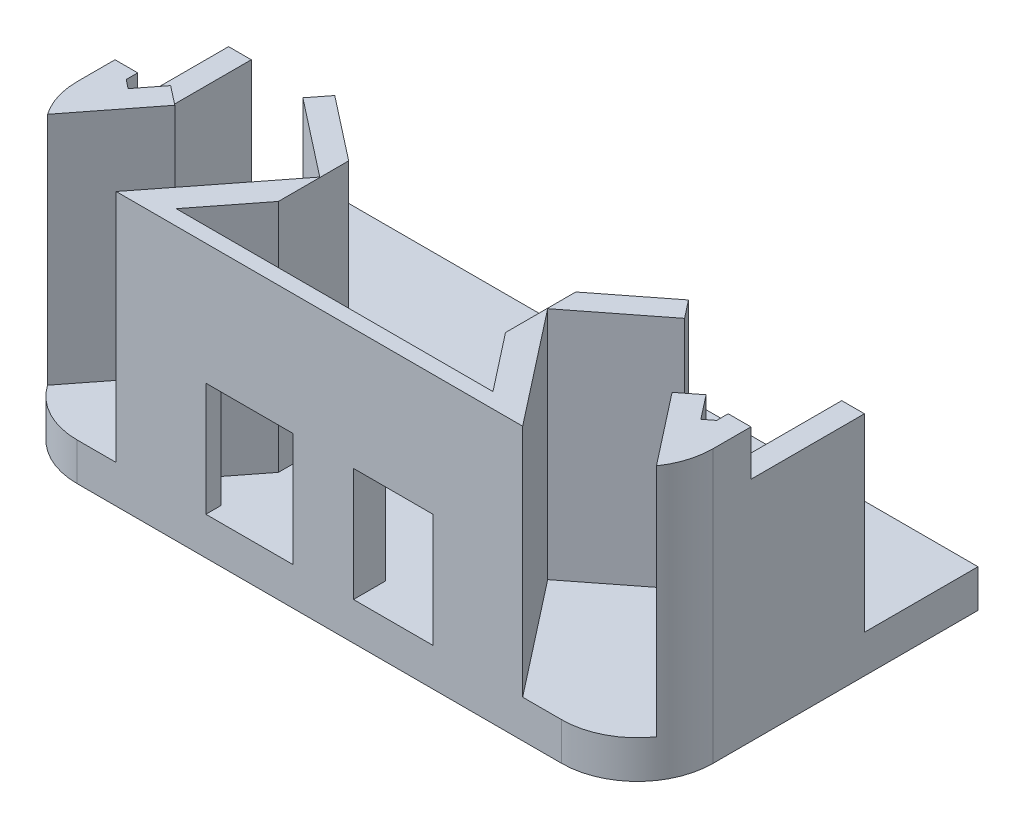
from build123d import *

# Parameters (mm, degrees)
SKETCH_1_W           = 84
SKETCH_1_H           = 30
EXTRUDE_1_DEPTH      = 34
CUT_EXTRUDE_1_DEPTH  = 30
SKETCH_4_W           = 15
SKETCH_4_H           = 18
CUT_EXTRUDE_4_DEPTH  = 30
CUT_EXTRUDE_6_DEPTH  = 30
SKETCH_8_W           = 78
SKETCH_8_H           = 28
CUT_EXTRUDE_7_DEPTH  = 30
EXTRUDE_4_DEPTH      = 30
EXTRUDE_5_DEPTH      = 30
SKETCH_11_W          = 30
SKETCH_11_H          = 18
CUT_EXTRUDE_9_DEPTH  = 61.860496219
CUT_EXTRUDE_12_DEPTH = 30
EXTRUDE_6_DEPTH      = 30
EXTRUDE_9_DEPTH      = 8
CUT_EXTRUDE_16_DEPTH = 30
EXTRUDE_10_DEPTH     = 30
SKETCH_27_W          = 84
SKETCH_27_H          = 1
CUT_EXTRUDE_17_DEPTH = 62.806148561
SKETCH_28_W          = 26.41372768
SKETCH_28_H          = 2
CUT_EXTRUDE_18_DEPTH = 12
SKETCH_29_W          = 2
SKETCH_29_H          = 18
EXTRUDE_11_DEPTH     = 30
SKETCH_30_W          = 30
SKETCH_30_H          = 18.863254254
CUT_EXTRUDE_19_DEPTH = 12
SKETCH_31_W          = 30
SKETCH_31_H          = 3
CUT_EXTRUDE_20_DEPTH = 12
SKETCH_32_W          = 15
SKETCH_32_H          = 5
CUT_EXTRUDE_21_DEPTH = 10
SKETCH_33_W          = 15
SKETCH_33_H          = 5
CUT_EXTRUDE_22_DEPTH = 10
SKETCH_39_W          = 30
SKETCH_39_H          = 3
EXTRUDE_12_DEPTH     = 1
CHAMFER_1_SIZE       = 10
CHAMFER_1_SIZE_2     = 5.773502692
EXTRUDE_13_DEPTH     = 8
EXTRUDE_14_DEPTH     = 22
FILLET_1_R           = 10
SKETCH_44_W          = 3.5
SKETCH_44_H          = 4.2
SKETCH_44_W_2        = 4.5
EXTRUDE_16_DEPTH     = 15
EXTRUDE_START        = 1
EXTRUDE_17_DEPTH     = 1
EXTRUDE_20_DEPTH     = 2
EXTRUDE_21_DEPTH     = 5
SKETCH_52_R          = 1.75
CUT_EXTRUDE_23_DEPTH = 10


with BuildPart() as part:
    # 草图1 → 凸台-拉伸1 (new body)
    with BuildSketch(Plane(origin=(0, 0, 0), x_dir=(1, 0, 0), z_dir=(0, 1, 0))):
        Rectangle(SKETCH_1_W, SKETCH_1_H)
    extrude(amount=EXTRUDE_1_DEPTH)

    # 草图2 → 切除-拉伸1 (cut)
    with BuildSketch(Plane(origin=(0, 34, 0), x_dir=(1, 0, 0), z_dir=(0, 1, 0))):
        Polygon((-39, 15), (-3.161634299, -13), (3.161634299, -13), (39, 15), align=None)
    extrude(amount=-CUT_EXTRUDE_1_DEPTH, mode=Mode.SUBTRACT)

    # 草图4 → 切除-拉伸4 (cut)
    with BuildSketch(Plane.XY.offset(15)):
        with Locations((-7.5, 25)):
            Rectangle(SKETCH_4_W, SKETCH_4_H)
        with Locations((7.5, 25)):
            Rectangle(SKETCH_4_W, SKETCH_4_H)
    extrude(amount=-CUT_EXTRUDE_4_DEPTH, mode=Mode.SUBTRACT)

    # 草图3 → 切除-拉伸6 (cut)
    with BuildSketch(Plane(origin=(0, 34, 0), x_dir=(1, 0, 0), z_dir=(0, 1, 0))):
        Polygon((-26.356961736, 5.122175929), (-42, -14.9), (-42, -15), (-26.849909982, -15), (-16.900832692, -2.265761775), align=None)
        Polygon((42, -14.9), (26.356961736, 5.122175929), (16.900832692, -2.265761775), (26.849909982, -15), (42, -15), align=None)
    extrude(amount=-CUT_EXTRUDE_6_DEPTH, mode=Mode.SUBTRACT)

    # 草图8 → 切除-拉伸7 (cut)
    with BuildSketch(Plane(origin=(0, 34, 0), x_dir=(1, 0, 0), z_dir=(0, 1, 0))):
        with Locations((0, 1)):
            Rectangle(SKETCH_8_W, SKETCH_8_H)
    extrude(amount=-CUT_EXTRUDE_7_DEPTH, mode=Mode.SUBTRACT)

    # 草图6 → 凸台-拉伸4 (add)
    with BuildSketch(Plane(origin=(0, 4, 0), x_dir=(1, 0, 0), z_dir=(0, 1, 0))):
        Polygon((-24.50997731, 7.486208189), (-15.053848266, 0.098270486), (-13.20686384, 2.462302746), (-22.662992884, 9.85024045), align=None)
        Polygon((13.20686384, 2.462302746), (22.662992884, 9.85024045), (24.50997731, 7.486208189), (15.053848266, 0.098270486), align=None)
    extrude(amount=EXTRUDE_4_DEPTH)

    # 草图9 → 凸台-拉伸5 (add)
    with BuildSketch(Plane(origin=(0, 4, 0), x_dir=(1, 0, 0), z_dir=(0, 1, 0))):
        Polygon((13.20686384, 2.462302746), (13.20686384, -13), (24.529623979, -13), (25.287338729, -13), (15.053848266, 0.098270486), align=None)
        Polygon((-15.053848266, 0.098270486), (-25.287338729, -13), (-24.529623979, -13), (-13.20686384, -13), (-13.20686384, 2.462302746), align=None)
    extrude(amount=EXTRUDE_5_DEPTH)

    # 草图11 → 切除-拉伸9 (cut, through all)
    with BuildSketch(Plane.XY.offset(13)):
        with Locations((0, 25)):
            Rectangle(SKETCH_11_W, SKETCH_11_H)
    extrude(amount=-CUT_EXTRUDE_9_DEPTH, mode=Mode.SUBTRACT)

    # 草图14 → 切除-拉伸12 (cut)
    with BuildSketch(Plane(origin=(0, 34, 0), x_dir=(1, 0, 0), z_dir=(0, 1, 0))):
        Polygon((-15, -5.416722485), (-20.924705724, -13), (-15, -13), align=None)
        Polygon((15, -13), (20.924705724, -13), (15, -5.416722485), align=None)
    extrude(amount=-CUT_EXTRUDE_12_DEPTH, mode=Mode.SUBTRACT)

    # 草图17 → 凸台-拉伸6 (add)
    with BuildSketch(Plane(origin=(0, 4, 0), x_dir=(1, 0, 0), z_dir=(0, 1, 0))):
        Polygon((-22.662992884, 9.85024045), (-23.392760551, 10.420397439), (-25.239744977, 8.056365178), (-24.50997731, 7.486208189), align=None)
        Polygon((22.662992884, 9.85024045), (23.359699806, 10.394567554), (25.206684232, 8.030535294), (24.50997731, 7.486208189), align=None)
    extrude(amount=EXTRUDE_6_DEPTH)

    # 草图23 → 凸台-拉伸9 (add)
    with BuildSketch(Plane(origin=(0, 4, 0), x_dir=(1, 0, 0), z_dir=(0, 1, 0))):
        Polygon((23.359699806, 10.394567554), (26.117737443, 12.549382718), (32.274352197, 4.669275182), (29.752717785, 2.699158461), (25.443087458, 8.215233736), (25.206684232, 8.030535294), align=None)
        Polygon((-25.206684232, 8.030535294), (-23.359699806, 10.394567554), (-26.117737443, 12.549382718), (-32.274352197, 4.669275182), (-29.752717785, 2.699158461), (-25.443087458, 8.215233736), align=None)
    extrude(amount=EXTRUDE_9_DEPTH)

    # 草图25 → 切除-拉伸16 (cut)
    with BuildSketch(Plane(origin=(0, 34, 0), x_dir=(1, 0, 0), z_dir=(0, 1, 0))):
        Polygon((-39, -11.060175103), (-39, -9.136823031), (-42, -12.976647927), (-42, -14.9), align=None)
        Polygon((42, -12.976647927), (42, -14.9), (39, -11.060175103), (39, -9.136823031), align=None)
    extrude(amount=-CUT_EXTRUDE_16_DEPTH, mode=Mode.SUBTRACT)

    # 草图26 → 凸台-拉伸10 (add)
    with BuildSketch(Plane(origin=(0, 4, 0), x_dir=(1, 0, 0), z_dir=(0, 1, 0))):
        Polygon((-39, -9.136823031), (-35.306031148, -4.408758509), (-39, -1.52271374), align=None)
        Polygon((39, -1.52271374), (39, -9.136823031), (35.306031148, -4.408758509), align=None)
    extrude(amount=EXTRUDE_10_DEPTH)

    # 草图27 → 切除-拉伸17 (cut, through all)
    with BuildSketch(Plane(origin=(0, 0, -15), x_dir=(-1, 0, 0), z_dir=(0, 0, -1))):
        with Locations((0, 0.5)):
            Rectangle(SKETCH_27_W, SKETCH_27_H)
    extrude(amount=-CUT_EXTRUDE_17_DEPTH, mode=Mode.SUBTRACT)

    # 草图28 → 切除-拉伸18 (cut)
    with BuildSketch(Plane(origin=(0, 16, 0), x_dir=(1, 0, 0), z_dir=(0, 1, 0))):
        with Locations((0, -14)):
            Rectangle(SKETCH_28_W, SKETCH_28_H)
    extrude(amount=-CUT_EXTRUDE_18_DEPTH, mode=Mode.SUBTRACT)

    # 草图29 → 凸台-拉伸11 (add)
    with BuildSketch(Plane(origin=(-15, 0, 0), x_dir=(0, 0, -1), z_dir=(1, 0, 0))):
        with Locations((-14, 25)):
            Rectangle(SKETCH_29_W, SKETCH_29_H)
    extrude(amount=EXTRUDE_11_DEPTH)

    # 草图30 → 切除-拉伸19 (cut)
    with BuildSketch(Plane(origin=(0, 16, 0), x_dir=(1, 0, 0), z_dir=(0, 1, 0))):
        with Locations((0, -5.568372873)):
            Rectangle(SKETCH_30_W, SKETCH_30_H)
    extrude(amount=-CUT_EXTRUDE_19_DEPTH, mode=Mode.SUBTRACT)

    # 草图31 → 切除-拉伸20 (cut)
    with BuildSketch(Plane.XY.offset(15)):
        with Locations((0, 17.5)):
            Rectangle(SKETCH_31_W, SKETCH_31_H)
    extrude(amount=-CUT_EXTRUDE_20_DEPTH, mode=Mode.SUBTRACT)

    # 草图32 → 切除-拉伸21 (cut)
    with BuildSketch(Plane.ZY.offset(42)):
        with Locations((-7.5, 31.5)):
            Rectangle(SKETCH_32_W, SKETCH_32_H)
    extrude(amount=-CUT_EXTRUDE_21_DEPTH, mode=Mode.SUBTRACT)

    # 草图33 → 切除-拉伸22 (cut)
    with BuildSketch(Plane(origin=(42, 0, 0), x_dir=(0, 0, -1), z_dir=(1, 0, 0))):
        with Locations((7.5, 31.5)):
            Rectangle(SKETCH_33_W, SKETCH_33_H)
    extrude(amount=-CUT_EXTRUDE_22_DEPTH, mode=Mode.SUBTRACT)

    # 草图39 → 凸台-拉伸12 (add)
    with BuildSketch(Plane(origin=(0, 0, -15), x_dir=(-1, 0, 0), z_dir=(0, 0, -1))):
        with Locations((0, 2.5)):
            Rectangle(SKETCH_39_W, SKETCH_39_H)
    extrude(amount=EXTRUDE_12_DEPTH)

    # 倒角1
    # the kernel refuses this chamfer: 10, 5.773502692 mm, written as the material it adds along each edge
    with BuildSketch(Plane(origin=(-15, 4, -15), x_dir=(-0.9998132206222079, 0, 0.01932676561270081), z_dir=(0, -1, 0))) as chamfer_1_piece_1_section:
        Polygon((CHAMFER_1_SIZE * 0.999813220622, CHAMFER_1_SIZE * 0.0193267656127), (-CHAMFER_1_SIZE_2 * 0.0193267656124, CHAMFER_1_SIZE_2 * 0.999813220604), (0, 0), align=None)
    chamfer_1_piece_1 = extrude(amount=3, mode=Mode.PRIVATE)
    chamfer_1_piece_1 = split(chamfer_1_piece_1, bisect_by=Plane(origin=(-19.75963278, 2.5, -16), z_dir=(0, 0, 1)), keep=Keep.TOP, mode=Mode.PRIVATE)
    add(chamfer_1_piece_1)
    with BuildSketch(Plane(origin=(15, 1, -15), x_dir=(0.9998132206222079, 0, 0.01932676561270081), z_dir=(0, 1, 0))) as chamfer_1_piece_2_section:
        Polygon((CHAMFER_1_SIZE * 0.999813220622, CHAMFER_1_SIZE * 0.0193267656127), (-CHAMFER_1_SIZE_2 * 0.0193267656124, CHAMFER_1_SIZE_2 * 0.999813220604), (0, 0), align=None)
    chamfer_1_piece_2 = extrude(amount=3, mode=Mode.PRIVATE)
    chamfer_1_piece_2 = split(chamfer_1_piece_2, bisect_by=Plane(origin=(19.75963278, 2.5, -16), z_dir=(0, 0, 1)), keep=Keep.TOP, mode=Mode.PRIVATE)
    add(chamfer_1_piece_2)

    # 草图41 → 凸台-拉伸13 (add)
    with BuildSketch(Plane(origin=(0, 4, 0), x_dir=(1, 0, 0), z_dir=(0, 1, 0))):
        Polygon((-32.274352197, 4.669275182), (-37.82766556, -2.438641788), (-35.306031148, -4.408758509), (-29.752717785, 2.699158461), align=None)
        Polygon((29.752717785, 2.699158461), (35.306031148, -4.408758509), (37.82766556, -2.438641788), (32.274352197, 4.669275182), align=None)
    extrude(amount=EXTRUDE_13_DEPTH)

    # 草图42 → 凸台-拉伸14 (add)
    with BuildSketch(Plane(origin=(0, 12, 0), x_dir=(1, 0, 0), z_dir=(0, 1, 0))):
        Polygon((35.306031148, -4.408758509), (32.843385247, -1.256715495), (35.365019658, 0.713401226), (37.82766556, -2.438641788), align=None)
        Polygon((-37.82766556, -2.438641788), (-35.306031148, -4.408758509), (-32.843385247, -1.256715495), (-35.365019658, 0.713401226), align=None)
    extrude(amount=EXTRUDE_14_DEPTH)

    # 圆角1
    fillet_1_edges = [part.edges().sort_by_distance(p)[0] for p in [
        (42, 2.5, 15),
        (-42, 2.5, 15),
    ]]
    fillet(fillet_1_edges, radius=FILLET_1_R)

    # 草图44 → 凸台-拉伸16 (add)
    with BuildSketch(Plane(origin=(0, 4, 0), x_dir=(1, 0, 0), z_dir=(0, 1, 0))):
        with Locations((-1.75, -12.9)):
            Rectangle(SKETCH_44_W, SKETCH_44_H)
        with Locations((2.25, -12.9)):
            Rectangle(SKETCH_44_W_2, SKETCH_44_H)
    extrude(amount=EXTRUDE_16_DEPTH)

    # 草图47 → 凸台-拉伸17 (add)
    with BuildSketch(Plane(origin=(0, 34, 0), x_dir=(1, 0, 0), z_dir=(0, 1, 0)).offset(EXTRUDE_START)):
        with BuildLine():
            Line((32.843385247, -1.256715495), (40.218723124, -10.696717495))
            ThreePointArc((40.218723124, -10.696717495), (41.544297545, -7.984356611), (42, -5))
            Line((42, -5), (42, 0))
            Line((42, 0), (39, 0))
            Line((39, 0), (39, -1.52271374))
            Line((39, -1.52271374), (37.82766556, -2.438641788))
            Line((37.82766556, -2.438641788), (35.365019658, 0.713401226))
            Line((35.365019658, 0.713401226), (32.843385247, -1.256715495))
        make_face()
        with BuildLine():
            Line((-42, 0), (-42, -5))
            ThreePointArc((-42, -5), (-41.544297545, -7.984356611), (-40.218723124, -10.696717495))
            Line((-40.218723124, -10.696717495), (-32.843385247, -1.256715495))
            Line((-32.843385247, -1.256715495), (-35.365019658, 0.713401226))
            Line((-35.365019658, 0.713401226), (-37.82766556, -2.438641788))
            Line((-37.82766556, -2.438641788), (-39, -1.52271374))
            Line((-39, -1.52271374), (-39, 0))
            Line((-39, 0), (-42, 0))
        make_face()
        Polygon((15, -5.416722485), (20.924705724, -13), (-20.924705724, -13), (-15, -5.416722485), (-15, 3.863254254), (-23.392760551, 10.420397439), (-25.239744977, 8.056365178), (-15.053848266, 0.098270486), (-26.849909982, -15), (26.849909982, -15), (15.053848266, 0.098270486), (25.206684232, 8.030535294), (23.359699806, 10.394567554), (15, 3.863254254), align=None)
    extrude(amount=-EXTRUDE_17_DEPTH)

    # 草图50 → 凸台-拉伸20 (add)
    with BuildSketch(Plane.XZ.offset(-1)):
        with BuildLine():
            Line((-42, -15), (-25, -15))
            Line((-25, -15), (-23.267949192, -16))
            Line((-23.267949192, -16), (23.267949192, -16))
            Line((23.267949192, -16), (25, -15))
            Line((25, -15), (42, -15))
            Line((42, -15), (42, 5))
            ThreePointArc((42, 5), (39.071067812, 12.071067812), (32, 15))
            Line((32, 15), (-32, 15))
            ThreePointArc((-32, 15), (-39.071067812, 12.071067812), (-42, 5))
            Line((-42, 5), (-42, -15))
        make_face()
    extrude(amount=EXTRUDE_20_DEPTH)

    # 草图51 → 凸台-拉伸21 (add)
    with BuildSketch(Plane(origin=(0, 4, 0), x_dir=(1, 0, 0), z_dir=(0, 1, 0))):
        Polygon((-42, 15), (-25, 15), (-23.267949192, 16), (23.267949192, 16), (25, 15), (42, 15), (42, 30), (-42, 30), align=None)
    extrude(amount=-EXTRUDE_21_DEPTH)

    # 草图52 → 切除-拉伸23 (cut)
    with BuildSketch(Plane.XZ.offset(1)):
        with Locations(Location((35, -17, 0), (0, 0, 270))):
            Circle(SKETCH_52_R)
        with Locations(Location((9, -23, 0), (0, 0, 270))):
            Circle(SKETCH_52_R)
        with Locations(Location((-9, -23, 0), (0, 0, 270))):
            Circle(SKETCH_52_R)
        with Locations(Location((-35, -17, 0), (0, 0, 270))):
            Circle(SKETCH_52_R)
    extrude(amount=-CUT_EXTRUDE_23_DEPTH, mode=Mode.SUBTRACT)


solid = part.part
